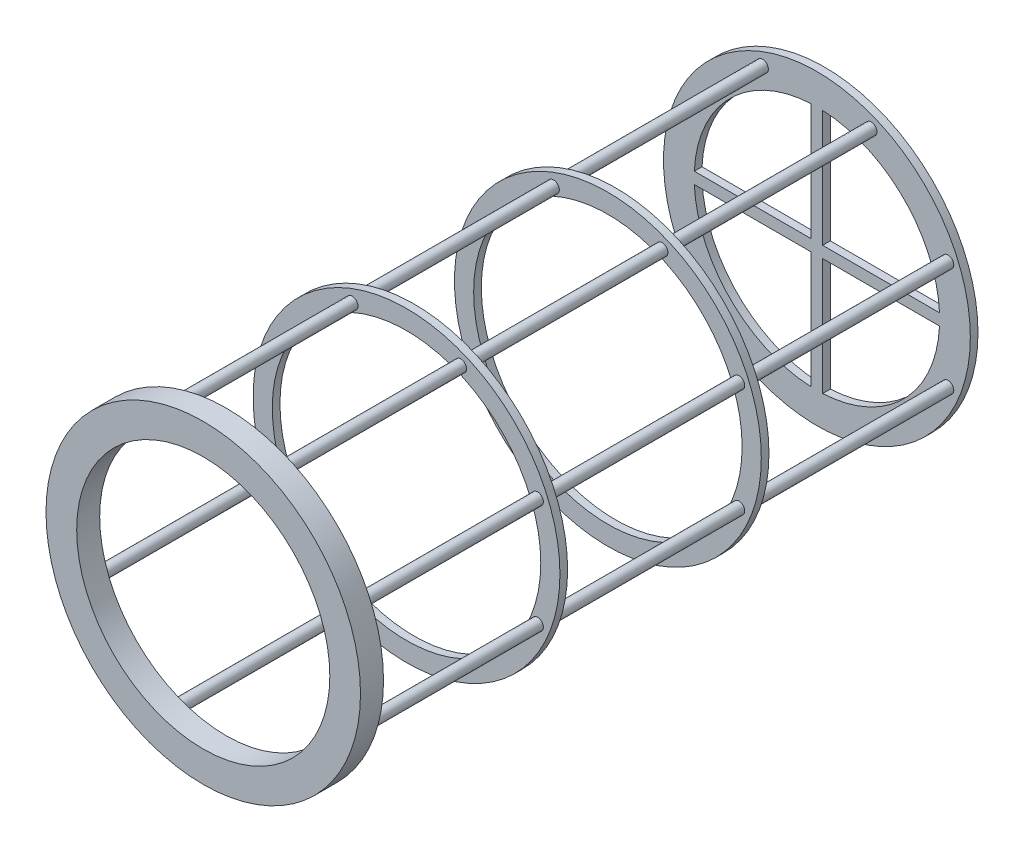
from build123d import *

# Parameters (mm, degrees)
EXTRUDE_START                           = -72
EXTRUDE_SKETCH_1_R                      = 82
EXTRUDE_SKETCH_1_R_2                    = 66
EXTRUDE_1_DEPTH                         = 12
EXTRUDE_START_2                         = -380
EXTRUDE_SKETCH_2_R                      = 3
EXTRUDE_2_DEPTH                         = 308
EXTRUDE_SKETCH_3_R                      = 3
EXTRUDE_3_DEPTH                         = 308
EXTRUDE_SKETCH_4_R                      = 3
EXTRUDE_4_DEPTH                         = 308
EXTRUDE_SKETCH_5_R                      = 3
EXTRUDE_5_DEPTH                         = 308
EXTRUDE_SKETCH_6_R                      = 3
EXTRUDE_6_DEPTH                         = 308
EXTRUDE_SKETCH_7_R                      = 3
EXTRUDE_7_DEPTH                         = 308
EXTRUDE_SKETCH_8_R                      = 3
EXTRUDE_8_DEPTH                         = 308
EXTRUDE_SKETCH_9_R                      = 3
EXTRUDE_9_DEPTH                         = 308
EXTRUDE_START_3                         = -170
EXTRUDE_SKETCH_10_R                     = 80
EXTRUDE_SKETCH_10_R_2                   = 70
EXTRUDE_10_DEPTH                        = 4
EXTRUDE_START_4                         = -275
EXTRUDE_SKETCH_11_R                     = 80
EXTRUDE_SKETCH_11_R_2                   = 70
EXTRUDE_11_DEPTH                        = 4
EXTRUDE_START_5                         = -384
EXTRUDE_SKETCH_12_R                     = 80
EXTRUDE_SKETCH_12_R_2                   = 64
EXTRUDE_12_DEPTH                        = 4
EXTRUDE_SKETCH_13_W                     = 129
EXTRUDE_SKETCH_13_H                     = 6
EXTRUDE_13_DEPTH                        = 4
EXTRUDE_SKETCH_14_W                     = 6
EXTRUDE_SKETCH_14_H                     = 61.49
EXTRUDE_14_DEPTH                        = 4
EXTRUDE_SKETCH_15_W                     = 6
EXTRUDE_SKETCH_15_H                     = 61.49
EXTRUDE_15_DEPTH                        = 4
COMBINE_START                           = -384
COMBINE_WELD_ASSEMBLY_OF_FEATURES_OUT_W = 6
COMBINE_WELD_ASSEMBLY_OF_FEATURES_OUT_H = 0.01
COMBINE_WELD_ASSEMBLY_OF_FEATURES_DEPTH = 4


# Read off the part's stored shape, not the designer's step: Combine (weld / assembly of features)
with BuildPart() as part:
    # Extrude sketch 1 → Extrude 1 (new body)
    with BuildSketch(Plane.XY.offset(EXTRUDE_START)):
        with Locations((240, 0)):
            Circle(EXTRUDE_SKETCH_1_R)
        with Locations((240, 0)):
            Circle(EXTRUDE_SKETCH_1_R_2, mode=Mode.SUBTRACT)
    extrude(amount=EXTRUDE_1_DEPTH)


with BuildPart() as body_2:
    # Extrude sketch 2 → Extrude 2 (new body)
    with BuildSketch(Plane.XY.offset(EXTRUDE_START_2)):
        with Locations((308.367085406, 28.318573995)):
            Circle(EXTRUDE_SKETCH_2_R)
    extrude(amount=EXTRUDE_2_DEPTH)


with BuildPart() as body_3:
    # Extrude sketch 3 → Extrude 3 (new body)
    with BuildSketch(Plane.XY.offset(EXTRUDE_START_2)):
        with Locations((268.318573995, 68.367085406)):
            Circle(EXTRUDE_SKETCH_3_R)
    extrude(amount=EXTRUDE_3_DEPTH)


with BuildPart() as body_4:
    # Extrude sketch 4 → Extrude 4 (new body)
    with BuildSketch(Plane.XY.offset(EXTRUDE_START_2)):
        with Locations((211.681426005, 68.367085406)):
            Circle(EXTRUDE_SKETCH_4_R)
    extrude(amount=EXTRUDE_4_DEPTH)


with BuildPart() as body_5:
    # Extrude sketch 5 → Extrude 5 (new body)
    with BuildSketch(Plane.XY.offset(EXTRUDE_START_2)):
        with Locations((171.632914594, 28.318573995)):
            Circle(EXTRUDE_SKETCH_5_R)
    extrude(amount=EXTRUDE_5_DEPTH)


with BuildPart() as body_6:
    # Extrude sketch 6 → Extrude 6 (new body)
    with BuildSketch(Plane.XY.offset(EXTRUDE_START_2)):
        with Locations((171.632914594, -28.318573995)):
            Circle(EXTRUDE_SKETCH_6_R)
    extrude(amount=EXTRUDE_6_DEPTH)


with BuildPart() as body_7:
    # Extrude sketch 7 → Extrude 7 (new body)
    with BuildSketch(Plane.XY.offset(EXTRUDE_START_2)):
        with Locations((211.681426005, -68.367085406)):
            Circle(EXTRUDE_SKETCH_7_R)
    extrude(amount=EXTRUDE_7_DEPTH)



with BuildPart() as body_8:
    # Extrude sketch 8 → Extrude 8 (new body)
    with BuildSketch(Plane.XY.offset(EXTRUDE_START_2)):
        with Locations((268.318573995, -68.367085406)):
            Circle(EXTRUDE_SKETCH_8_R)
    extrude(amount=EXTRUDE_8_DEPTH)


with BuildPart() as body_9:
    # Extrude sketch 9 → Extrude 9 (new body)
    with BuildSketch(Plane.XY.offset(EXTRUDE_START_2)):
        with Locations((308.367085406, -28.318573995)):
            Circle(EXTRUDE_SKETCH_9_R)
    extrude(amount=EXTRUDE_9_DEPTH)


with BuildPart() as body_10:
    # Extrude sketch 10 → Extrude 10 (new body)
    with BuildSketch(Plane.XY.offset(EXTRUDE_START_3)):
        with Locations((240, 0)):
            Circle(EXTRUDE_SKETCH_10_R)
        with Locations((240, 0)):
            Circle(EXTRUDE_SKETCH_10_R_2, mode=Mode.SUBTRACT)
    extrude(amount=EXTRUDE_10_DEPTH)


with BuildPart() as body_11:
    # Extrude sketch 11 → Extrude 11 (new body)
    with BuildSketch(Plane.XY.offset(EXTRUDE_START_4)):
        with Locations((240, 0)):
            Circle(EXTRUDE_SKETCH_11_R)
        with Locations((240, 0)):
            Circle(EXTRUDE_SKETCH_11_R_2, mode=Mode.SUBTRACT)
    extrude(amount=EXTRUDE_11_DEPTH)


with BuildPart() as body_12:
    # Extrude sketch 12 → Extrude 12 (new body)
    with BuildSketch(Plane.XY.offset(EXTRUDE_START_5)):
        with Locations((240, 0)):
            Circle(EXTRUDE_SKETCH_12_R)
        with Locations((240, 0)):
            Circle(EXTRUDE_SKETCH_12_R_2, mode=Mode.SUBTRACT)
    extrude(amount=EXTRUDE_12_DEPTH)


with BuildPart() as body_13:
    # Extrude sketch 13 → Extrude 13 (new body)
    with BuildSketch(Plane.XY.offset(EXTRUDE_START_5)):
        with Locations((240, 0)):
            Rectangle(EXTRUDE_SKETCH_13_W, EXTRUDE_SKETCH_13_H)
    extrude(amount=EXTRUDE_13_DEPTH)


with BuildPart() as body_14:
    # Extrude sketch 14 → Extrude 14 (new body)
    with BuildSketch(Plane.XY.offset(EXTRUDE_START_5)):
        with Locations((240, -33.755)):
            Rectangle(EXTRUDE_SKETCH_14_W, EXTRUDE_SKETCH_14_H)
    extrude(amount=EXTRUDE_14_DEPTH)


with BuildPart() as body_15:
    # Extrude sketch 15 → Extrude 15 (new body)
    with BuildSketch(Plane.XY.offset(EXTRUDE_START_5)):
        with Locations((240, 33.755)):
            Rectangle(EXTRUDE_SKETCH_15_W, EXTRUDE_SKETCH_15_H)
    extrude(amount=EXTRUDE_15_DEPTH)


with BuildPart() as body_7_1:
    add(body_7.part)

    add(body_14.part)  # Combine (weld / assembly of features) merges body 14

    add(body_10.part)  # Combine (weld / assembly of features) merges body 10

    add(body_9.part)  # Combine (weld / assembly of features) merges body 9

    add(body_11.part)  # Combine (weld / assembly of features) merges body 11

    add(part.part)  # Combine (weld / assembly of features) merges part

    add(body_2.part)  # Combine (weld / assembly of features) merges body 2

    add(body_12.part)  # Combine (weld / assembly of features) merges body 12

    add(body_8.part)  # Combine (weld / assembly of features) merges body 8

    add(body_13.part)  # Combine (weld / assembly of features) merges body 13

    add(body_5.part)  # Combine (weld / assembly of features) merges body 5

    add(body_4.part)  # Combine (weld / assembly of features) merges body 4

    add(body_6.part)  # Combine (weld / assembly of features) merges body 6

    add(body_15.part)  # Combine (weld / assembly of features) merges body 15

    add(body_3.part)  # Combine (weld / assembly of features) merges body 3
    # Combine (weld / assembly of features) out → Combine (weld / assembly of features) (add)
    with BuildSketch(Plane.XY.offset(COMBINE_START)):
        with Locations((240, 3.005)):
            Rectangle(COMBINE_WELD_ASSEMBLY_OF_FEATURES_OUT_W, COMBINE_WELD_ASSEMBLY_OF_FEATURES_OUT_H)
        with Locations((240, -3.005)):
            Rectangle(COMBINE_WELD_ASSEMBLY_OF_FEATURES_OUT_W, COMBINE_WELD_ASSEMBLY_OF_FEATURES_OUT_H)
    extrude(amount=COMBINE_WELD_ASSEMBLY_OF_FEATURES_DEPTH)


solid = body_7_1.part
